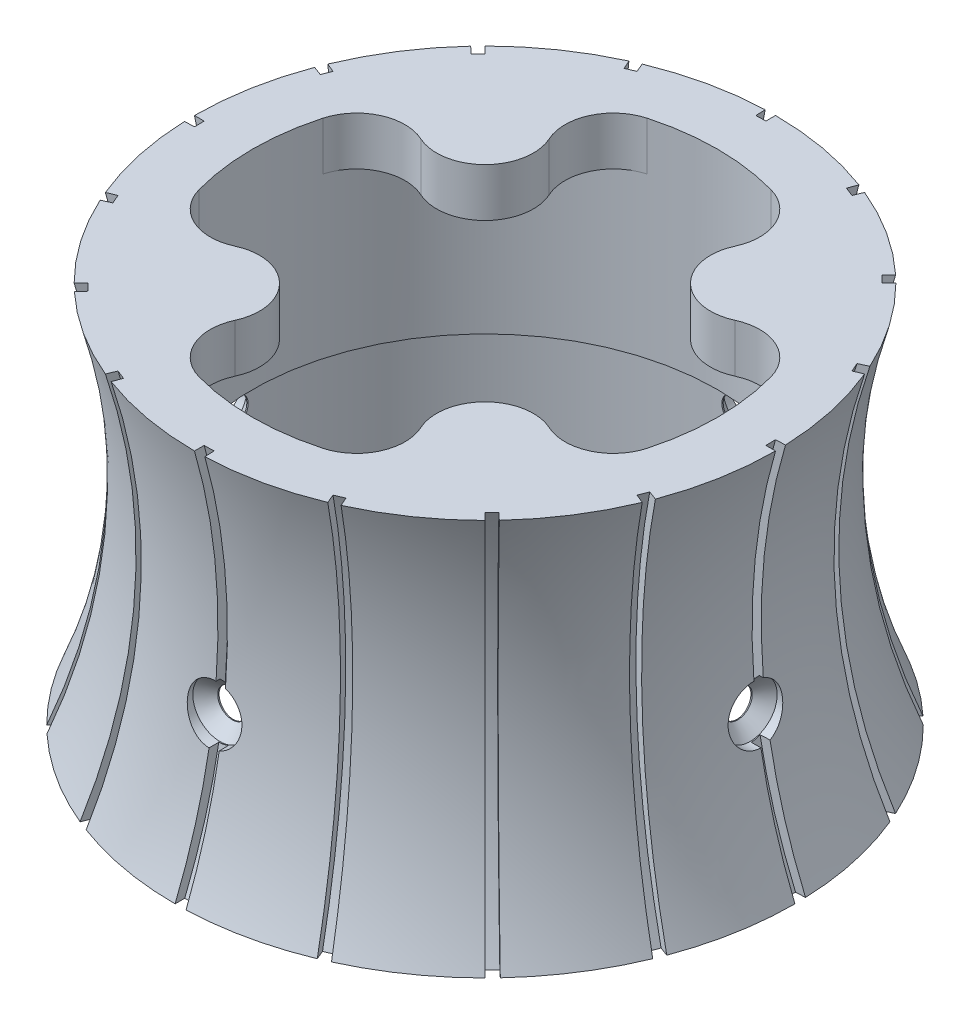
from build123d import *

# Parameters (mm, degrees)
CUT_EXTRUDE1_REACH            = 56.854
CUT_EXTRUDE1_END_MAJOR_RADIUS = 87.57501047611377
CUT_EXTRUDE1_END_MINOR_RADIUS = 60
SKETCH2_R                     = 1.5000000000000004
CIRPATTERN1_COUNT             = 4
BOSS_EXTRUDE1_START           = -5
BOSS_EXTRUDE1_DEPTH           = 5
CIRPATTERN2_COUNT             = 4
SKETCH4_R                     = 2.5000000000000004
CUT_EXTRUDE2_DEPTH            = 3
CIRPATTERN3_COUNT             = 4
FILLET2_R                     = 5
CIRPATTERN5_COUNT             = 4
CUT_REVOLVE1_ANGLE            = 2.0000000000000044
CIRPATTERN4_COUNT             = 16


with BuildPart() as part:
    # Sketch1 → Revolve1 (revolve)
    with BuildSketch(Plane.XY, mode=Mode.PRIVATE) as revolve1_sk:
        with BuildLine():
            Line((-24, 9.500000000000002), (-26, 9.5))
            Line((-26, 9.5), (-25.999999999999996, -8.499999999999998))
            Line((-25.999999999999996, -8.499999999999998), (-31.999999999999993, -8.499999999999998))
            ThreePointArc((-31.999999999999993, -8.499999999999998), (-27.651773661232156, 11.080469552467456), (-30.000000000000007, 31.000000000000004))
            Line((-30.000000000000007, 31.000000000000004), (-24.000000000000004, 31.000000000000007))
            Line((-24.000000000000004, 31.000000000000007), (-24, 9.500000000000002))
        make_face()
    revolve(revolve1_sk.sketch.rotate(Axis((0, 0, 0), (0, 1, 0)), 270), axis=Axis((0, 0, 0), (0, 1, 0)))

    # Cut-Extrude1: up to this torus (the profile starts outside it)
    cut_extrude1_end = Plane(origin=(0, 14.114557492461444, 0), z_dir=(0, -1, 0)) * Torus(CUT_EXTRUDE1_END_MAJOR_RADIUS, CUT_EXTRUDE1_END_MINOR_RADIUS, mode=Mode.PRIVATE)
    # Sketch2 → Cut-Extrude1 (cut, up to the surface)
    with BuildSketch(Plane.XY, mode=Mode.PRIVATE) as cut_extrude1_sk1:
        with Locations(Location((0, 6.500000000000002, 0), (0, 0, 90.000000034))):
            Circle(SKETCH2_R)
    cut_extrude1_tool1 = extrude(cut_extrude1_sk1.sketch, amount=-CUT_EXTRUDE1_REACH, mode=Mode.PRIVATE) - cut_extrude1_end
    cut_extrude1 = cut_extrude1_tool1.solids().sort_by_distance((0, 6.5, 0))[0]
    add(cut_extrude1, mode=Mode.SUBTRACT)

    # CirPattern1: Cut-Extrude1 ×4 about axis
    cirpattern1_axis = Axis((0, 0, 0), (0, -1, 0))
    for i in range(1, CIRPATTERN1_COUNT):
        add(cut_extrude1.rotate(cirpattern1_axis, i * 360 / CIRPATTERN1_COUNT), mode=Mode.SUBTRACT)

    # Sketch3 → Boss-Extrude1 (add)
    with BuildSketch(Plane(origin=(0, 31, 0), x_dir=(1, 0, 0), z_dir=(0, 1, 0)).offset(BOSS_EXTRUDE1_START)):
        with BuildLine():
            Line((-10.606601717798245, 17.677669529663667), (-13.062658766765132, 20.133726578630547))
            ThreePointArc((-13.062658766765132, 20.133726578630547), (-16.97056274847717, 16.970562748477114), (-20.133726578630593, 13.06265876676506))
            Line((-20.133726578630593, 13.06265876676506), (-17.677669529663717, 10.606601717798187))
            ThreePointArc((-17.677669529663717, 10.606601717798187), (-10.606601717798235, 10.606601717798185), (-10.606601717798245, 17.677669529663667))
        make_face()
    boss_extrude1 = extrude(amount=BOSS_EXTRUDE1_DEPTH)

    # CirPattern2: Boss-Extrude1 ×4 about axis
    cirpattern2_axis = Axis((-9.42e-15, 0, 9.93e-15), (0, 1, 0))
    for i in range(1, CIRPATTERN2_COUNT):
        add(boss_extrude1.rotate(cirpattern2_axis, i * 360 / CIRPATTERN2_COUNT))

    # Sketch4 → Cut-Extrude2 (cut)
    with BuildSketch(Plane.XZ.offset(-26)):
        with Locations(Location((-14.142135623730875, 14.142135623731026, 0), (0, 0, 270))):
            Circle(SKETCH4_R)
    cut_extrude2 = extrude(amount=-CUT_EXTRUDE2_DEPTH, mode=Mode.SUBTRACT)

    # CirPattern3: Cut-Extrude2 ×4 about axis
    cirpattern3_axis = Axis((2.472e-14, 0, 2.472e-14), (0, 1, 0))
    for i in range(1, CIRPATTERN3_COUNT):
        add(cut_extrude2.rotate(cirpattern3_axis, i * 360 / CIRPATTERN3_COUNT), mode=Mode.SUBTRACT)

    # Fillet2
    # the kernel refuses this fillet: 5 mm, written as the material it adds along each edge
    with BuildSketch(Plane(origin=(-20.133726578630565, 26, 13.06265876676513), x_dir=(-0.40994989037982243, 0, -0.9121080458901629), z_dir=(0, 1, 0))) as fillet2_piece_1:
        with BuildLine():
            CenterArc((6.558820741483289, -4.941493653255407), FILLET2_R, 81.22638621328038, 99.23744678181913)
            Line((1.558984579865343, -4.981970275860687), (1.059000963703549, -4.986017938121215))
            ThreePointArc((1.059000963703549, -4.986017938121215), (0.7659110116083878, -3.4245894320132524), (-0.46741806592899865, -0.17753971849474498))
            Line((-0.46741806592899865, -0.17753971849474498), (-0.07626535745910813, 0.4941493653255401))
            ThreePointArc((-0.07626535745910813, 0.4941493653255401), (3.660737158037177, 0.780830464374055), (7.3977396735334615, 0.49414936532553916))
            Line((7.3977396735334615, 0.49414936532553916), (7.321474316074355, -1.6e-16))
        make_face()
    extrude(amount=5)
    with BuildSketch(Plane(origin=(-13.062658766765082, 26, 20.133726578630593), x_dir=(0.9121080458901635, 0, 0.4099498903798213), z_dir=(0, 1, 0))) as fillet2_piece_2:
        with BuildLine():
            CenterArc((6.558820741483278, 4.941493653255407), FILLET2_R, 179.53616700490056, 99.23744678181913)
            Line((1.5589845798653332, 4.981970275860682), (1.0590009637035374, 4.9860179381212095))
            ThreePointArc((1.0590009637035374, 4.9860179381212095), (0.7659110116083807, 3.424589432013242), (-0.4674180659289984, 0.17753971849474556))
            Line((-0.4674180659289984, 0.17753971849474556), (-0.07626535745910874, -0.49414936532554005))
            ThreePointArc((-0.07626535745910874, -0.49414936532554005), (3.660737158037172, -0.78083046437405), (7.397739673533458, -0.4941493653255425))
            Line((7.397739673533458, -0.4941493653255425), (7.32147431607435, -6e-17))
        make_face()
    extrude(amount=5)
    with BuildSketch(Plane(origin=(13.06265876676511, 26, 20.13372657863057), x_dir=(-0.9121080458901628, 0, 0.4099498903798227), z_dir=(0, 1, 0))) as fillet2_piece_3:
        with BuildLine():
            CenterArc((6.558820741483285, -4.941493653255404), FILLET2_R, 81.22638621328026, 99.2374467818193)
            Line((1.55898457986534, -4.981970275860687), (1.059000963703546, -4.986017938121214))
            ThreePointArc((1.059000963703546, -4.986017938121214), (0.7659110116083852, -3.4245894320132515), (-0.4674180659289987, -0.1775397184947448))
            Line((-0.4674180659289987, -0.1775397184947448), (-0.07626535745910797, 0.49414936532554016))
            ThreePointArc((-0.07626535745910797, 0.49414936532554016), (3.660737158037185, 0.7808304643740583), (7.397739673533466, 0.49414936532553877))
            Line((7.397739673533466, 0.49414936532553877), (7.32147431607436, -8e-17))
        make_face()
    extrude(amount=5)
    with BuildSketch(Plane(origin=(20.133726578630576, 26, 13.062658766765082), x_dir=(0.4099498903798234, 0, -0.9121080458901625), z_dir=(0, 1, 0))) as fillet2_piece_4:
        with BuildLine():
            CenterArc((6.558820741483274, 4.941493653255405), FILLET2_R, 179.53616700490056, 99.23744678181924)
            Line((1.558984579865328, 4.98197027586068), (1.0590009637035338, 4.986017938121208))
            ThreePointArc((1.0590009637035338, 4.986017938121208), (0.7659110116083695, 3.4245894320132426), (-0.4674180659289988, 0.17753971849474448))
            Line((-0.4674180659289988, 0.17753971849474448), (-0.07626535745910762, -0.4941493653255402))
            ThreePointArc((-0.07626535745910762, -0.4941493653255402), (3.6607371580371697, -0.7808304643740588), (7.397739673533464, -0.4941493653255421))
            Line((7.397739673533464, -0.4941493653255421), (7.321474316074355, 4e-17))
        make_face()
    extrude(amount=5)
    with BuildSketch(Plane(origin=(20.13372657863055, 26, -13.062658766765107), x_dir=(0.4099498903798255, 0, 0.9121080458901616), z_dir=(0, 1, 0))) as fillet2_piece_5:
        with BuildLine():
            CenterArc((6.55882074148326, -4.941493653255404), FILLET2_R, 81.22638621328018, 99.2374467818193)
            Line((1.5589845798653132, -4.981970275860682), (1.0590009637035194, -4.986017938121209))
            ThreePointArc((1.0590009637035194, -4.986017938121209), (0.7659110116083733, -3.4245894320132533), (-0.46741806592899926, -0.1775397184947434))
            Line((-0.46741806592899926, -0.1775397184947434), (-0.0762653574591065, 0.4941493653255404))
            ThreePointArc((-0.0762653574591065, 0.4941493653255404), (3.6607371580371804, 0.780830464374062), (7.397739673533453, 0.49414936532553905))
            Line((7.397739673533453, 0.49414936532553905), (7.321474316074344, 2.6e-16))
        make_face()
    extrude(amount=5)
    with BuildSketch(Plane(origin=(13.062658766765066, 26, -20.133726578630572), x_dir=(-0.9121080458901621, 0, -0.40994989037982404), z_dir=(0, 1, 0))) as fillet2_piece_6:
        with BuildLine():
            CenterArc((6.558820741483271, 4.941493653255402), FILLET2_R, 179.53616700490056, 99.23744678181936)
            Line((1.5589845798653255, 4.981970275860678), (1.0590009637035316, 4.986017938121205))
            ThreePointArc((1.0590009637035316, 4.986017938121205), (0.76591101160837, 3.4245894320132404), (-0.46741806592900054, 0.1775397184947434))
            Line((-0.46741806592900054, 0.1775397184947434), (-0.07626535745910724, -0.4941493653255402))
            ThreePointArc((-0.07626535745910724, -0.4941493653255402), (3.660737158037176, -0.7808304643740651), (7.39773967353347, -0.4941493653255419))
            Line((7.39773967353347, -0.4941493653255419), (7.321474316074361, 3.5e-16))
        make_face()
    extrude(amount=5)
    with BuildSketch(Plane(origin=(-13.062658766765132, 26, -20.133726578630547), x_dir=(0.9121080458901616, 0, -0.4099498903798253), z_dir=(0, 1, 0))) as fillet2_piece_7:
        with BuildLine():
            CenterArc((6.5588207414832675, -4.941493653255405), FILLET2_R, 81.22638621328024, 99.23744678181924)
            Line((1.558984579865322, -4.981970275860681), (1.059000963703528, -4.986017938121208))
            ThreePointArc((1.059000963703528, -4.986017938121208), (0.7659110116083754, -3.4245894320132537), (-0.46741806592899915, -0.17753971849474348))
            Line((-0.46741806592899915, -0.17753971849474348), (-0.07626535745910817, 0.4941493653255411))
            ThreePointArc((-0.07626535745910817, 0.4941493653255411), (3.6607371580371706, 0.780830464374055), (7.397739673533454, 0.49414936532553905))
            Line((7.397739673533454, 0.49414936532553905), (7.3214743160743465, -1.1e-16))
        make_face()
    extrude(amount=5)
    with BuildSketch(Plane(origin=(-20.133726578630593, 26, -13.062658766765061), x_dir=(-0.4099498903798219, 0, 0.9121080458901633), z_dir=(0, 1, 0))) as fillet2_piece_8:
        with BuildLine():
            CenterArc((6.558820741483278, 4.941493653255404), FILLET2_R, 179.5361670049005, 99.23744678181924)
            Line((1.558984579865332, 4.981970275860684), (1.059000963703538, 4.986017938121212))
            ThreePointArc((1.059000963703538, 4.986017938121212), (0.7659110116083786, 3.424589432013243), (-0.4674180659290002, 0.17753971849474456))
            Line((-0.4674180659290002, 0.17753971849474456), (-0.07626535745910845, -0.4941493653255401))
            ThreePointArc((-0.07626535745910845, -0.4941493653255401), (3.660737158037177, -0.7808304643740537), (7.397739673533467, -0.49414936532554193))
            Line((7.397739673533467, -0.49414936532554193), (7.321474316074358, 1.3e-16))
        make_face()
    extrude(amount=5)

    # Sketch9 → Cut-Revolve2 (revolve, cut)
    with BuildSketch(Plane(origin=(0, 0, 0), x_dir=(0, 0, -1), z_dir=(1, 0, 0)), mode=Mode.PRIVATE) as cut_revolve2_sk:
        Polygon((27.768488790332846, 6.5000000000000036), (26.068488790332847, 6.500000000000002), (26.068488790332847, 7.974277113152371), (27.368488790332837, 9.300000000000002), (27.76848879033285, 9.300000000000002), (28.515698910159383, 9.299999999999999), (28.515698910159383, 6.5), align=None)
    cut_revolve2 = revolve(cut_revolve2_sk.sketch.rotate(Axis((0, 6.500000000000002, 0), (0, 0, -1)), 90), axis=Axis((0, 6.500000000000002, 0), (0, 0, -1)), mode=Mode.SUBTRACT)

    # CirPattern5: Cut-Revolve2 ×4 about axis
    cirpattern5_axis = Axis((0, 0, 0), (0, -1, 0))
    for i in range(1, CIRPATTERN5_COUNT):
        add(cut_revolve2.rotate(cirpattern5_axis, i * 360 / CIRPATTERN5_COUNT), mode=Mode.SUBTRACT)

    # Sketch5 → Cut-Revolve1 (revolve, cut)
    with BuildSketch(Plane.XY):
        with BuildLine():
            Line((-30, 30.999999999999996), (-28.999999999999996, 31.000000000000004))
            ThreePointArc((-28.999999999999996, 31.000000000000004), (-26.651773661232156, 11.080469552467452), (-30.999999999999993, -8.499999999999998))
            Line((-30.999999999999993, -8.499999999999998), (-31.999999999999993, -8.499999999999998))
            ThreePointArc((-31.999999999999993, -8.499999999999998), (-27.651773661232156, 11.080469552467449), (-30, 30.999999999999996))
        make_face()
    cut_revolve1 = revolve(axis=Axis((0, 0, 0), (0, 1, 0)), revolution_arc=CUT_REVOLVE1_ANGLE, mode=Mode.SUBTRACT)

    # CirPattern4: Cut-Revolve1 ×16 about axis
    cirpattern4_axis = Axis((1.5e-16, 0, 3.8e-16), (0, 1, 0))
    for i in range(1, CIRPATTERN4_COUNT):
        add(cut_revolve1.rotate(cirpattern4_axis, i * 360 / CIRPATTERN4_COUNT), mode=Mode.SUBTRACT)


solid = part.part
